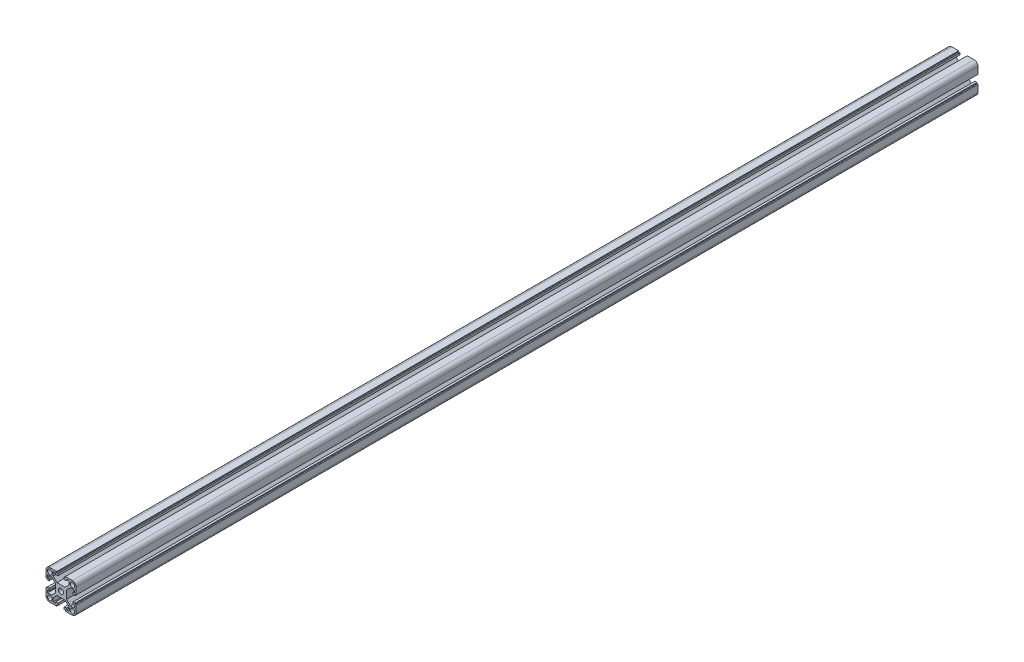
from build123d import *

# Parameters (mm, degrees)
SKETCH_1_R      = 3.4
SKETCH_1_R_2    = 3.15
EXTRUDE_1_DEPTH = 600


with BuildPart() as part:
    # Эскиз1 → Бобышка-Вытянуть1 (new, symmetric)
    with BuildSketch(Plane.XY):
        with BuildLine():
            Line((-15, 20), (-5.727351849, 20))
            Line((-5.727351849, 20), (-5.727351849, 18.530416438))
            Line((-5.727351849, 18.530416438), (-4.25, 18.530416438))
            Line((-4.25, 18.530416438), (-4.25, 15.732027397))
            Line((-4.25, 15.732027397), (-7.111831817, 15.732027397))
            Line((-7.111831817, 15.732027397), (-7.111831817, 17.7))
            Line((-7.111831817, 17.7), (-10.5, 17.7))
            Line((-10.5, 17.7), (-10.5, 12.479898987))
            Line((-10.5, 12.479898987), (-5.420101013, 7.4))
            Line((-5.420101013, 7.4), (5.420101013, 7.4))
            Line((5.420101013, 7.4), (10.5, 12.479898987))
            Line((10.5, 12.479898987), (10.5, 17.7))
            Line((10.5, 17.7), (7.111831817, 17.7))
            Line((7.111831817, 17.7), (7.111831817, 15.732027397))
            Line((7.111831817, 15.732027397), (4.25, 15.732027397))
            Line((4.25, 15.732027397), (4.25, 18.530416438))
            Line((4.25, 18.530416438), (5.727351849, 18.530416438))
            Line((5.727351849, 18.530416438), (5.727351849, 20))
            Line((5.727351849, 20), (15, 20))
            ThreePointArc((15, 20), (18.535533906, 18.535533906), (20, 15))
            Line((20, 15), (20, 5.727351849))
            Line((20, 5.727351849), (18.530416438, 5.727351849))
            Line((18.530416438, 5.727351849), (18.530416438, 4.25))
            Line((18.530416438, 4.25), (15.732027397, 4.25))
            Line((15.732027397, 4.25), (15.732027397, 7.111831817))
            Line((15.732027397, 7.111831817), (17.7, 7.111831817))
            Line((17.7, 7.111831817), (17.7, 10.5))
            Line((17.7, 10.5), (12.479898987, 10.5))
            Line((12.479898987, 10.5), (7.4, 5.420101013))
            Line((7.4, 5.420101013), (7.4, -5.420101013))
            Line((7.4, -5.420101013), (12.479898987, -10.5))
            Line((12.479898987, -10.5), (17.7, -10.5))
            Line((17.7, -10.5), (17.7, -7.111831817))
            Line((17.7, -7.111831817), (15.732027397, -7.111831817))
            Line((15.732027397, -7.111831817), (15.732027397, -4.25))
            Line((15.732027397, -4.25), (18.530416438, -4.25))
            Line((18.530416438, -4.25), (18.530416438, -5.727351849))
            Line((18.530416438, -5.727351849), (20, -5.727351849))
            Line((20, -5.727351849), (20, -15))
            ThreePointArc((20, -15), (18.535533906, -18.535533906), (15, -20))
            Line((15, -20), (5.727351849, -20))
            Line((5.727351849, -20), (5.727351849, -18.530416438))
            Line((5.727351849, -18.530416438), (4.25, -18.530416438))
            Line((4.25, -18.530416438), (4.25, -15.732027397))
            Line((4.25, -15.732027397), (7.111831817, -15.732027397))
            Line((7.111831817, -15.732027397), (7.111831817, -17.7))
            Line((7.111831817, -17.7), (10.5, -17.7))
            Line((10.5, -17.7), (10.5, -12.479898987))
            Line((10.5, -12.479898987), (5.420101013, -7.4))
            Line((5.420101013, -7.4), (-5.420101013, -7.4))
            Line((-5.420101013, -7.4), (-10.5, -12.479898987))
            Line((-10.5, -12.479898987), (-10.5, -17.7))
            Line((-10.5, -17.7), (-7.111831817, -17.7))
            Line((-7.111831817, -17.7), (-7.111831817, -15.732027397))
            Line((-7.111831817, -15.732027397), (-4.25, -15.732027397))
            Line((-4.25, -15.732027397), (-4.25, -18.530416438))
            Line((-4.25, -18.530416438), (-5.727351849, -18.530416438))
            Line((-5.727351849, -18.530416438), (-5.727351849, -20))
            Line((-5.727351849, -20), (-15, -20))
            ThreePointArc((-15, -20), (-18.535533906, -18.535533906), (-20, -15))
            Line((-20, -15), (-20, -5.727351849))
            Line((-20, -5.727351849), (-18.530416438, -5.727351849))
            Line((-18.530416438, -5.727351849), (-18.530416438, -4.25))
            Line((-18.530416438, -4.25), (-15.732027397, -4.25))
            Line((-15.732027397, -4.25), (-15.732027397, -7.111831817))
            Line((-15.732027397, -7.111831817), (-17.7, -7.111831817))
            Line((-17.7, -7.111831817), (-17.7, -10.5))
            Line((-17.7, -10.5), (-12.479898987, -10.5))
            Line((-12.479898987, -10.5), (-7.4, -5.420101013))
            Line((-7.4, -5.420101013), (-7.4, 5.420101013))
            Line((-7.4, 5.420101013), (-12.479898987, 10.5))
            Line((-12.479898987, 10.5), (-17.7, 10.5))
            Line((-17.7, 10.5), (-17.7, 7.111831817))
            Line((-17.7, 7.111831817), (-15.732027397, 7.111831817))
            Line((-15.732027397, 7.111831817), (-15.732027397, 4.25))
            Line((-15.732027397, 4.25), (-18.530416438, 4.25))
            Line((-18.530416438, 4.25), (-18.530416438, 5.727351849))
            Line((-18.530416438, 5.727351849), (-20, 5.727351849))
            Line((-20, 5.727351849), (-20, 15))
            ThreePointArc((-20, 15), (-18.535533906, 18.535533906), (-15, 20))
        make_face()
        Circle(SKETCH_1_R, mode=Mode.SUBTRACT)
        with Locations((-15, 15)):
            Circle(SKETCH_1_R_2, mode=Mode.SUBTRACT)
        with Locations((15, 15)):
            Circle(SKETCH_1_R_2, mode=Mode.SUBTRACT)
        with Locations((15, -15)):
            Circle(SKETCH_1_R_2, mode=Mode.SUBTRACT)
        with Locations((-15, -15)):
            Circle(SKETCH_1_R_2, mode=Mode.SUBTRACT)
    extrude(amount=EXTRUDE_1_DEPTH, both=True)


solid = part.part
